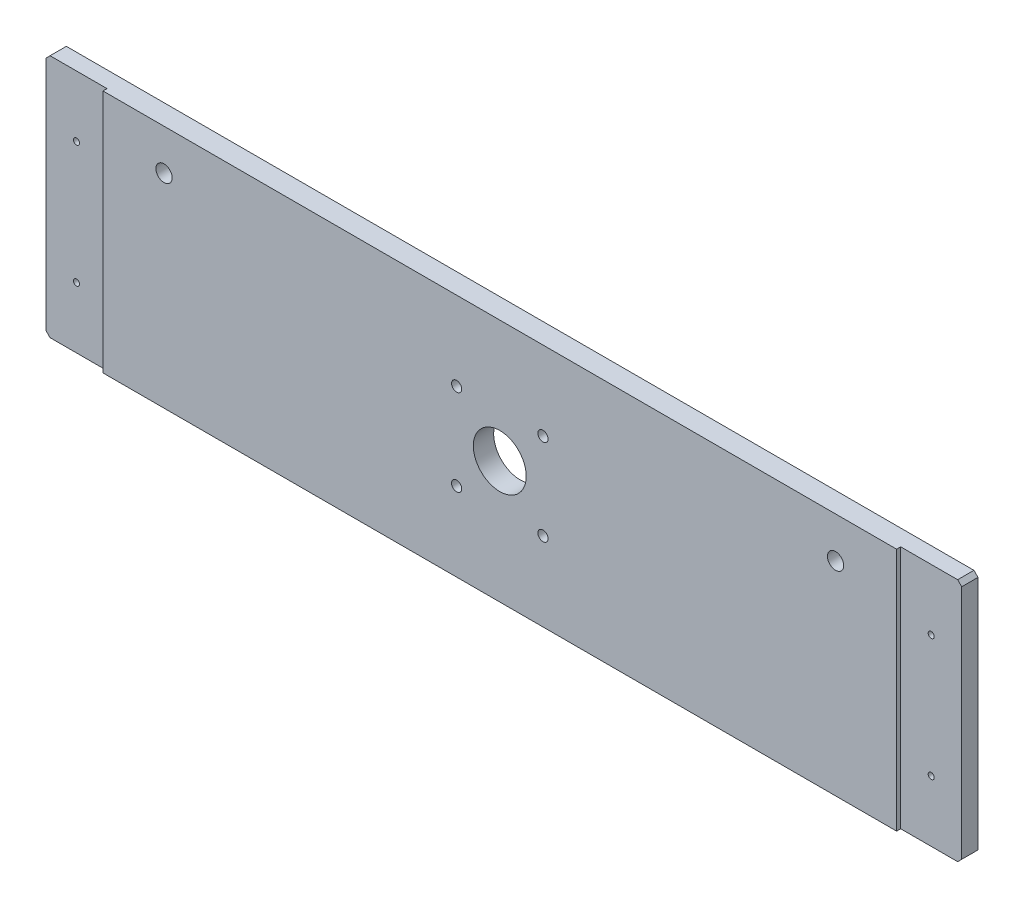
from build123d import *

# Parameters (mm, degrees)
SCHIZZO1_R                   = 13
SCHIZZO1_R_2                 = 2.5
SCHIZZO1_R_3                 = 4
SCHIZZO1_R_4                 = 1.5
ESTRUSIONE_ESTRUSIONE1_DEPTH = 10
SCHIZZO2_W                   = 30
SCHIZZO2_H                   = 120
TAGLIO_ESTRUSIONE1_DEPTH     = 2


with BuildPart() as part:
    # Schizzo1 → Estrusione-Estrusione1 (new body)
    with BuildSketch(Plane.XY):
        Polygon((2, 0), (448, 0), (450, 2), (450, 118), (448, 120), (2, 120), (0, 118), (0, 2), align=None)
        with Locations((225, 60)):
            Circle(SCHIZZO1_R, mode=Mode.SUBTRACT)
        with Locations((246.213203436, 81.213203436)):
            Circle(SCHIZZO1_R_2, mode=Mode.SUBTRACT)
        with Locations((390, 100)):
            Circle(SCHIZZO1_R_3, mode=Mode.SUBTRACT)
        with Locations((246.213203436, 38.786796564)):
            Circle(SCHIZZO1_R_2, mode=Mode.SUBTRACT)
        with Locations((203.786796564, 38.786796564)):
            Circle(SCHIZZO1_R_2, mode=Mode.SUBTRACT)
        with Locations((60, 100)):
            Circle(SCHIZZO1_R_3, mode=Mode.SUBTRACT)
        with Locations((15, 30)):
            Circle(SCHIZZO1_R_4, mode=Mode.SUBTRACT)
        with Locations((435, 30)):
            Circle(SCHIZZO1_R_4, mode=Mode.SUBTRACT)
        with Locations((203.786796564, 81.213203436)):
            Circle(SCHIZZO1_R_2, mode=Mode.SUBTRACT)
        with Locations((435, 90)):
            Circle(SCHIZZO1_R_4, mode=Mode.SUBTRACT)
        with Locations((15, 90)):
            Circle(SCHIZZO1_R_4, mode=Mode.SUBTRACT)
    extrude(amount=-ESTRUSIONE_ESTRUSIONE1_DEPTH)

    # Schizzo2 → Taglio-Estrusione1 (cut)
    with BuildSketch(Plane.XY):
        with Locations((15, 60)):
            Rectangle(SCHIZZO2_W, SCHIZZO2_H)
        with Locations((435, 60)):
            Rectangle(SCHIZZO2_W, SCHIZZO2_H)
    extrude(amount=-TAGLIO_ESTRUSIONE1_DEPTH, mode=Mode.SUBTRACT)


solid = part.part
